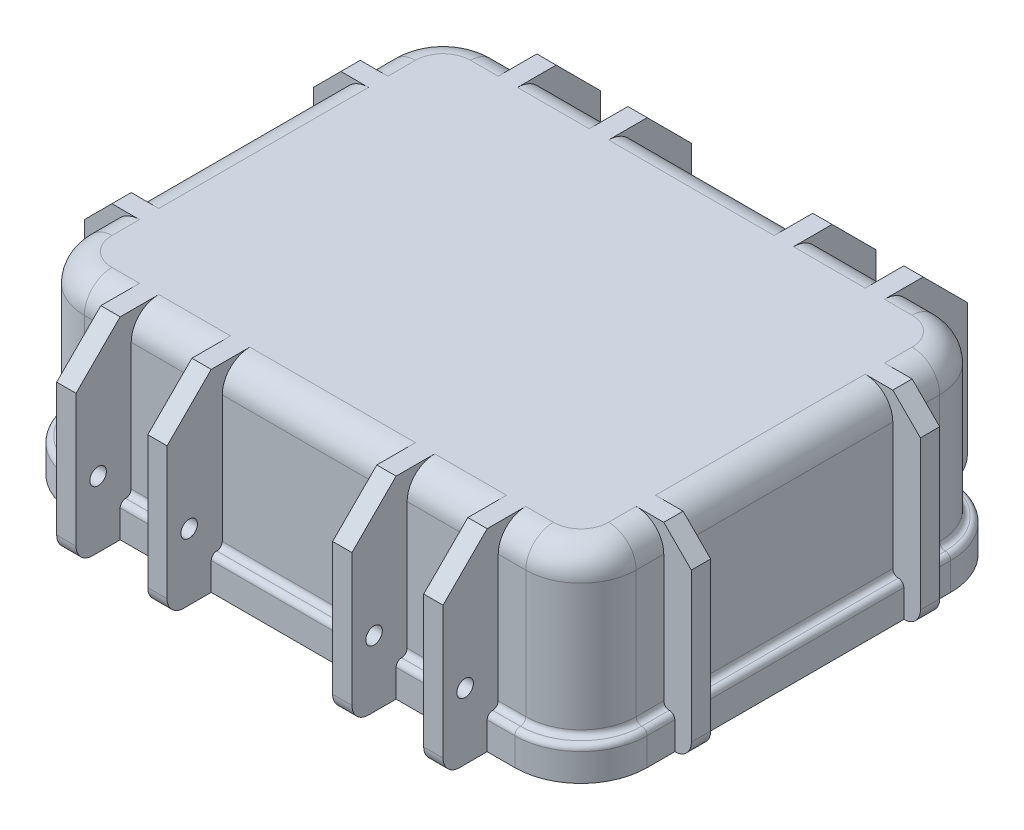
from build123d import *

# Parameters (mm, degrees)
BOSS_EXTRUDE1_DEPTH     = 35
BOSS_EXTRUDE2_DEPTH     = 6
CUT_EXTRUDE1_DEPTH      = 56
CUT_EXTRUDE1_DEPTH_BACK = 56
SKETCH3_R               = 1.5
CHAMFER1_SIZE           = 5
CHAMFER2_SIZE           = 8
FILLET3_R               = 1
FILLET4_R               = 3
FILLET6_R               = 5
CUT_EXTRUDE3_DEPTH      = 2
CUT_EXTRUDE2_DEPTH      = 20
CUT_EXTRUDE4_DEPTH      = 3
SKETCH8_R               = 1.8
CUT_EXTRUDE5_DEPTH      = 7
CUT_EXTRUDE6_DEPTH      = 13
CUT_EXTRUDE6_DEPTH_BACK = 13


with BuildPart() as part:
    # Sketch1 → Boss-Extrude1 (new body)
    with BuildSketch(Plane(origin=(0, 0, 0), x_dir=(1, 0, 0), z_dir=(0, 1, 0))):
        with BuildLine():
            Line((-35, 37.5), (-35, 47.5))
            Line((-35, 47.5), (-31.5, 47.5))
            Line((-31.5, 47.5), (-31.5, 37.5))
            Line((-31.5, 37.5), (-18.5, 37.5))
            Line((-18.5, 37.5), (-18.5, 47.5))
            Line((-18.5, 47.5), (-15, 47.5))
            Line((-15, 47.5), (-15, 37.5))
            Line((-15, 37.5), (15, 37.5))
            Line((15, 37.5), (15, 47.5))
            Line((15, 47.5), (18.5, 47.5))
            Line((18.5, 47.5), (18.5, 37.5))
            Line((18.5, 37.5), (31.5, 37.5))
            Line((31.5, 37.5), (31.5, 47.5))
            Line((31.5, 47.5), (35, 47.5))
            Line((35, 47.5), (35, 37.5))
            Line((35, 37.5), (40, 37.5))
            ThreePointArc((40, 37.5), (47.071067812, 34.571067812), (50, 27.5))
            Line((50, 27.5), (50, 22.5))
            Line((50, 22.5), (55, 22.5))
            Line((55, 22.5), (55, 19))
            Line((55, 19), (50, 19))
            Line((50, 19), (50, -19))
            Line((50, -19), (55, -19))
            Line((55, -19), (55, -22.5))
            Line((55, -22.5), (50, -22.5))
            Line((50, -22.5), (50, -27.5))
            ThreePointArc((50, -27.5), (47.071067812, -34.571067812), (40, -37.5))
            Line((40, -37.5), (35, -37.5))
            Line((35, -37.5), (35, -47.5))
            Line((35, -47.5), (31.5, -47.5))
            Line((31.5, -47.5), (31.5, -37.5))
            Line((31.5, -37.5), (18.5, -37.5))
            Line((18.5, -37.5), (18.5, -47.5))
            Line((18.5, -47.5), (15, -47.5))
            Line((15, -47.5), (15, -37.5))
            Line((15, -37.5), (-15, -37.5))
            Line((-15, -37.5), (-15, -47.5))
            Line((-15, -47.5), (-18.5, -47.5))
            Line((-18.5, -47.5), (-18.5, -37.5))
            Line((-18.5, -37.5), (-31.5, -37.5))
            Line((-31.5, -37.5), (-31.5, -47.5))
            Line((-31.5, -47.5), (-35, -47.5))
            Line((-35, -47.5), (-35, -37.5))
            Line((-35, -37.5), (-40, -37.5))
            ThreePointArc((-40, -37.5), (-47.071067812, -34.571067812), (-50, -27.5))
            Line((-50, -27.5), (-50, -22.5))
            Line((-50, -22.5), (-55, -22.5))
            Line((-55, -22.5), (-55, -19))
            Line((-55, -19), (-50, -19))
            Line((-50, -19), (-50, 19))
            Line((-50, 19), (-55, 19))
            Line((-55, 19), (-55, 22.5))
            Line((-55, 22.5), (-50, 22.5))
            Line((-50, 22.5), (-50, 27.5))
            ThreePointArc((-50, 27.5), (-47.071067812, 34.571067812), (-40, 37.5))
            Line((-40, 37.5), (-35, 37.5))
        make_face()
    extrude(amount=BOSS_EXTRUDE1_DEPTH)

    # Sketch2 → Boss-Extrude2 (add)
    with BuildSketch(Plane(origin=(0, 0, 0), x_dir=(1, 0, 0), z_dir=(0, 1, 0))):
        with BuildLine():
            Line((-40, 39.5), (40, 39.5))
            ThreePointArc((40, 39.5), (48.485281374, 35.985281374), (52, 27.5))
            Line((52, 27.5), (52, -27.5))
            ThreePointArc((52, -27.5), (48.485281374, -35.985281374), (40, -39.5))
            Line((40, -39.5), (-40, -39.5))
            ThreePointArc((-40, -39.5), (-48.485281374, -35.985281374), (-52, -27.5))
            Line((-52, -27.5), (-52, 27.5))
            ThreePointArc((-52, 27.5), (-48.485281374, 35.985281374), (-40, 39.5))
        make_face()
    extrude(amount=BOSS_EXTRUDE2_DEPTH)

    # Sketch3 → Cut-Extrude1 (cut, two sides: drawn at the far end of the back side and taken through both)
    with BuildSketch(Plane(origin=(0, 0, 0), x_dir=(0, 0, -1), z_dir=(1, 0, 0)).offset(-CUT_EXTRUDE1_DEPTH_BACK)):
        with Locations(Location((-43.5, 12, 0), (0, 0, 180))):
            Circle(SKETCH3_R)
        with Locations(Location((43.5, 12, 0), (0, 0, 180))):
            Circle(SKETCH3_R)
    extrude(amount=CUT_EXTRUDE1_DEPTH + CUT_EXTRUDE1_DEPTH_BACK, mode=Mode.SUBTRACT)

    # Chamfer1
    chamfer1_edges = [part.edges().sort_by_distance(p)[0] for p in [
        (55, 35, -20.75),
        (55, 35, 20.75),
        (-55, 35, 20.75),
        (-55, 35, -20.75),
    ]]
    chamfer(chamfer1_edges, length=CHAMFER1_SIZE)

    # Chamfer2
    chamfer2_edges = [part.edges().sort_by_distance(p)[0] for p in [
        (16.75, 35, -47.5),
        (-16.75, 35, -47.5),
        (-33.25, 35, 47.5),
        (-33.25, 35, -47.5),
        (-16.75, 35, 47.5),
        (16.75, 35, 47.5),
        (33.25, 35, 47.5),
        (33.25, 35, -47.5),
    ]]
    chamfer(chamfer2_edges, length=CHAMFER2_SIZE)

    # Fillet3
    fillet3_edges = [part.edges().sort_by_distance(p)[0] for p in [
        (52, 6, 0),
        (50, 6, 0),
        (37.5, 6, 39.5),
        (52, 6, 25),
        (37.5, 6, 37.5),
        (50, 6, 25),
        (-52, 6, 25),
        (-37.5, 6, 39.5),
        (-50, 6, 25),
        (-37.5, 6, 37.5),
        (-37.5, 6, -39.5),
        (-52, 6, -25),
        (-37.5, 6, -37.5),
        (-50, 6, -25),
        (52, 6, -25),
        (37.5, 6, -39.5),
        (37.5, 6, -37.5),
        (47.071067812, 6, -34.571067812),
        (0, 6, 39.5),
        (0, 6, 37.5),
        (25, 6, 39.5),
        (25, 6, 37.5),
        (-25, 6, 39.5),
        (-25, 6, 37.5),
        (48.485281374, 6, 35.985281374),
        (47.071067812, 6, 34.571067812),
        (-48.485281374, 6, 35.985281374),
        (-47.071067812, 6, 34.571067812),
        (-52, 6, 0),
        (-50, 6, 0),
        (-48.485281374, 6, -35.985281374),
        (-47.071067812, 6, -34.571067812),
        (-25, 6, -39.5),
        (-25, 6, -37.5),
        (0, 6, -39.5),
        (0, 6, -37.5),
        (25, 6, -39.5),
        (25, 6, -37.5),
        (48.485281374, 6, -35.985281374),
        (50, 6, -25),
    ]]
    fillet(fillet3_edges, radius=FILLET3_R - 0.0001)  # a hair under: the kernel refuses the full size

    # Fillet4
    fillet4_edges = [part.edges().sort_by_distance(p)[0] for p in [
        (55, 0, -20.75),
        (55, 0, 20.75),
        (33.25, 0, 47.5),
        (16.75, 0, 47.5),
        (-16.75, 0, 47.5),
        (-33.25, 0, 47.5),
        (-55, 0, 20.75),
        (-55, 0, -20.75),
        (-33.25, 0, -47.5),
        (-16.75, 0, -47.5),
        (16.75, 0, -47.5),
        (33.25, 0, -47.5),
    ]]
    fillet(fillet4_edges, radius=FILLET4_R)

    # Fillet6
    fillet6_edges = [part.edges().sort_by_distance(p)[0] for p in [
        (25, 35, -37.5),
        (0, 35, -37.5),
        (-25, 35, -37.5),
        (-37.5, 35, -37.5),
        (-47.071067812, 35, -34.571067812),
        (-50, 35, -25),
        (-50, 35, 0),
        (-50, 35, 25),
        (-25, 35, 37.5),
        (0, 35, 37.5),
        (-47.071067812, 35, 34.571067812),
        (25, 35, 37.5),
        (37.5, 35, 37.5),
        (47.071067812, 35, 34.571067812),
        (50, 35, 25),
        (-37.5, 35, 37.5),
        (50, 35, 0),
        (50, 35, -25),
        (47.071067812, 35, -34.571067812),
        (37.5, 35, -37.5),
    ]]
    fillet(fillet6_edges, radius=FILLET6_R)

    # Sketch6 → Cut-Extrude3 (cut)
    with BuildSketch(Plane.XZ):
        with BuildLine():
            Line((-40, 37.5), (40, 37.5))
            ThreePointArc((40, 37.5), (47.071067812, 34.571067812), (50, 27.5))
            Line((50, 27.5), (50, -27.5))
            ThreePointArc((50, -27.5), (47.071067812, -34.571067812), (40, -37.5))
            Line((40, -37.5), (-40, -37.5))
            ThreePointArc((-40, -37.5), (-47.071067812, -34.571067812), (-50, -27.5))
            Line((-50, -27.5), (-50, 27.5))
            ThreePointArc((-50, 27.5), (-47.071067812, 34.571067812), (-40, 37.5))
        make_face()
        with BuildLine():
            Line((-40, 35.5), (40, 35.5))
            ThreePointArc((40, 35.5), (45.656854249, 33.156854249), (48, 27.5))
            Line((48, 27.5), (48, -27.5))
            ThreePointArc((48, -27.5), (45.656854249, -33.156854249), (40, -35.5))
            Line((40, -35.5), (-40, -35.5))
            ThreePointArc((-40, -35.5), (-45.656854249, -33.156854249), (-48, -27.5))
            Line((-48, -27.5), (-48, 27.5))
            ThreePointArc((-48, 27.5), (-45.656854249, 33.156854249), (-40, 35.5))
        make_face(mode=Mode.SUBTRACT)
    extrude(amount=-CUT_EXTRUDE3_DEPTH, mode=Mode.SUBTRACT)

    # Sketch5 → Cut-Extrude2 (cut)
    with BuildSketch(Plane.XZ):
        with BuildLine():
            Line((-40, 33.5), (40, 33.5))
            ThreePointArc((40, 33.5), (44.242640687, 31.742640687), (46, 27.5))
            Line((46, 27.5), (46, -27.5))
            ThreePointArc((46, -27.5), (44.242640687, -31.742640687), (40, -33.5))
            Line((40, -33.5), (-40, -33.5))
            ThreePointArc((-40, -33.5), (-44.242640687, -31.742640687), (-46, -27.5))
            Line((-46, -27.5), (-46, 27.5))
            ThreePointArc((-46, 27.5), (-44.242640687, 31.742640687), (-40, 33.5))
        make_face()
    extrude(amount=-CUT_EXTRUDE2_DEPTH, mode=Mode.SUBTRACT)

    # Sketch7 → Cut-Extrude4 (cut)
    with BuildSketch(Plane.XZ.offset(-20)):
        with BuildLine():
            Line((-29.5, 22), (-13, 22))
            Line((-13, 22), (-13, -22))
            Line((-13, -22), (-29.5, -22))
            ThreePointArc((-29.5, -22), (-33.035533906, -20.535533906), (-34.5, -17))
            Line((-34.5, -17), (-34.5, 17))
            ThreePointArc((-34.5, 17), (-33.035533906, 20.535533906), (-29.5, 22))
        make_face()
        with BuildLine():
            Line((29.5, 22), (13, 22))
            Line((13, 22), (13, -22))
            Line((13, -22), (29.5, -22))
            ThreePointArc((29.5, -22), (33.035533906, -20.535533906), (34.5, -17))
            Line((34.5, -17), (34.5, 17))
            ThreePointArc((34.5, 17), (33.035533906, 20.535533906), (29.5, 22))
        make_face()
    extrude(amount=-CUT_EXTRUDE4_DEPTH, mode=Mode.SUBTRACT)

    # Sketch8 → Cut-Extrude5 (cut)
    with BuildSketch(Plane.XZ.offset(-23)):
        with Locations(Location((-23, 0, 0), (0, 0, 270))):
            Circle(SKETCH8_R)
        with Locations(Location((23, 0, 0), (0, 0, 270))):
            Circle(SKETCH8_R)
    extrude(amount=-CUT_EXTRUDE5_DEPTH, mode=Mode.SUBTRACT)

    # Sketch9 → Cut-Extrude6 (cut, two sides: drawn at the far end of the back side and taken through both)
    with BuildSketch(Plane(origin=(0, 0, 0), x_dir=(0, 0, -1), z_dir=(1, 0, 0)).offset(-CUT_EXTRUDE6_DEPTH_BACK)):
        with BuildLine():
            Line((-21.5, 20), (21.5, 20))
            ThreePointArc((21.5, 20), (0, 29.36409372), (-21.5, 20))
        make_face()
    extrude(amount=CUT_EXTRUDE6_DEPTH + CUT_EXTRUDE6_DEPTH_BACK, mode=Mode.SUBTRACT)


solid = part.part
